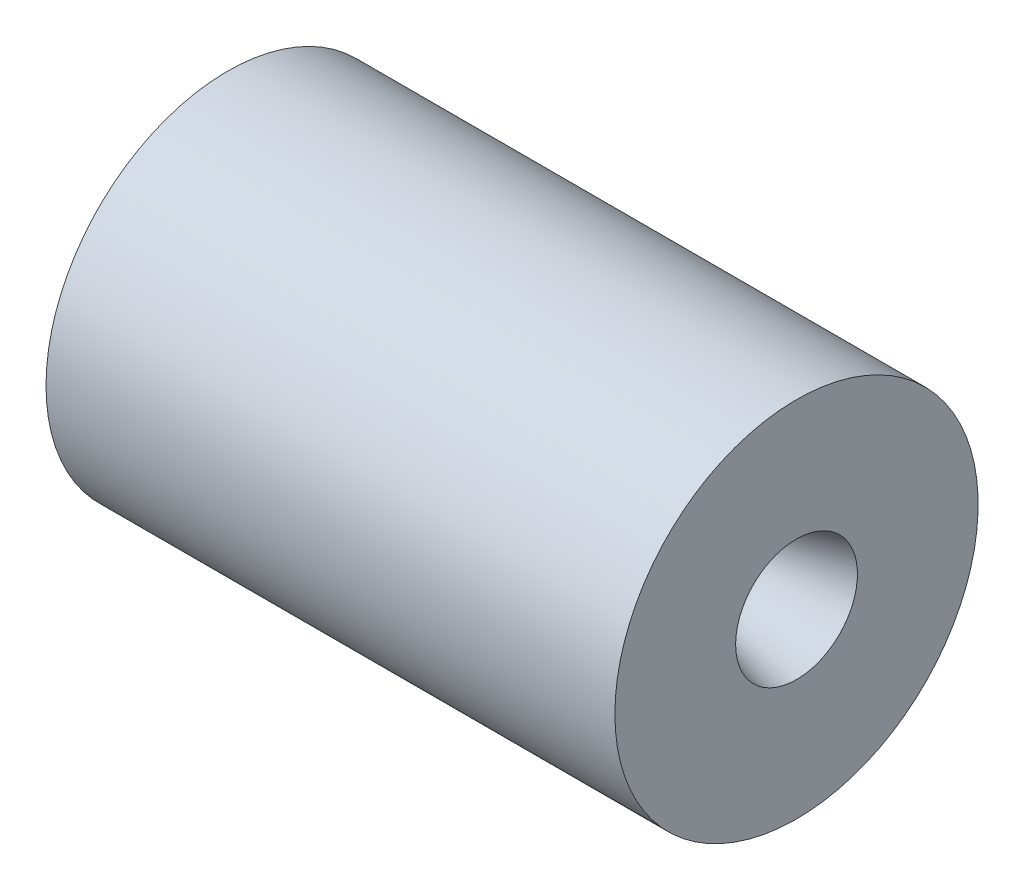
from build123d import *


with BuildPart() as part:
    # Sketch1 → Revolve1 (revolve)
    with BuildSketch(Plane.XY):
        with BuildLine():
            Line((-57.482999588, 19.05), (-18.926427283, 19.05))
            ThreePointArc((-18.926427283, 19.05), (-14.731391707, 18.069235016), (-11.406001811, 15.330256106))
            Line((-11.406001811, 15.330256106), (-3.676186486, 5.207))
            ThreePointArc((-3.676186486, 5.207), (-2.051025346, 3.857735121), (0, 3.3528))
            ThreePointArc((0, 3.3528), (0.414402348, 3.375072305), (0.821750452, 3.4544))
            Line((0.821750452, 3.4544), (18.172025124, 8.100703128))
            Line((18.172025124, 8.100703128), (18.172025124, 24.1554))
            Line((18.172025124, 24.1554), (-57.482999588, 24.1554))
            Line((-57.482999588, 24.1554), (-57.482999588, 19.05))
        make_face()
    revolve(axis=Axis((-50.899256216, 0, 0), (1, 0, 0)))


solid = part.part
